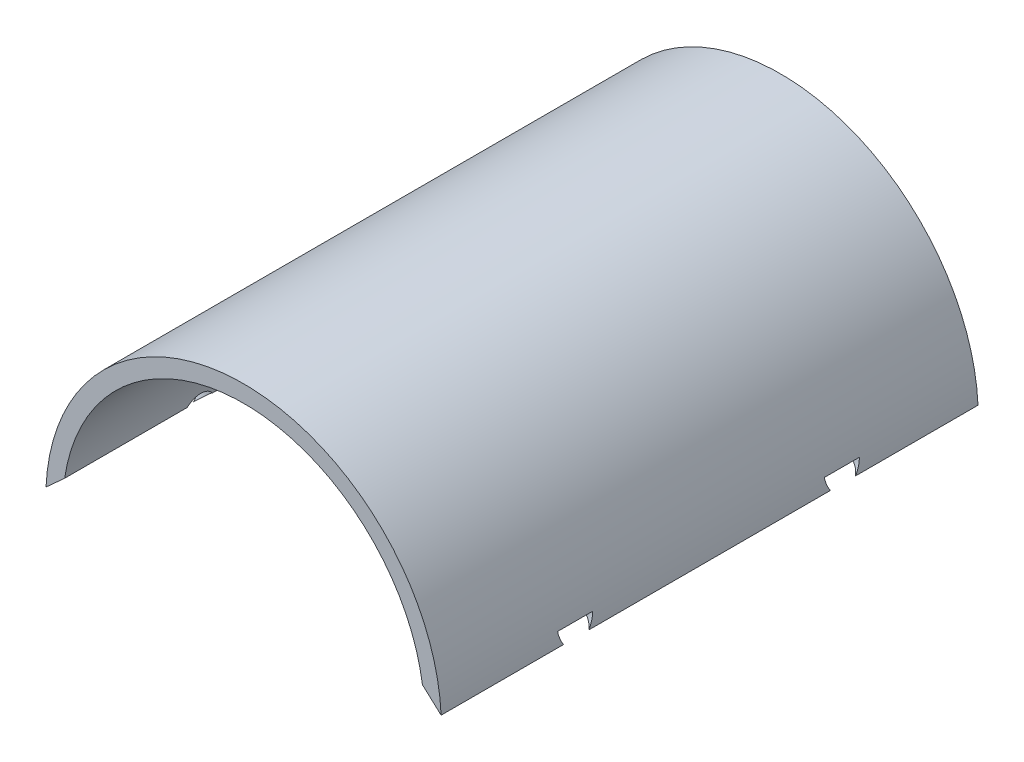
from build123d import *

# Parameters (mm, degrees)
BOSS_EXTRUDE1_DEPTH = 120.65
SKETCH2_R           = 4
CUT_EXTRUDE1_DEPTH  = 2
SKETCH3_R           = 4
CUT_EXTRUDE2_DEPTH  = 2.032


with BuildPart() as part:
    # Sketch1 → Boss-Extrude1 (new body)
    with BuildSketch(Plane.XY):
        with BuildLine():
            Line((-40.203883769, 5.937788296), (-44.399042974, 2.127788296))
            ThreePointArc((-44.399042974, 2.127788296), (0, 44.45), (44.399042974, 2.127788296))
            Line((44.399042974, 2.127788296), (40.203883769, 5.937788296))
            ThreePointArc((40.203883769, 5.937788296), (0, 40.64), (-40.203883769, 5.937788296))
        make_face()
    extrude(amount=BOSS_EXTRUDE1_DEPTH)

    # Sketch2 → Cut-Extrude1 (cut)
    with BuildSketch(Plane(origin=(-21.127225221, 23.263011377, 0), x_dir=(0.7402720771062569, 0.6723074087475075, 0), z_dir=(0.6723074087475075, -0.7402720771062569, 0))):
        with Locations((-28.603318705, 90.297)):
            Circle(SKETCH2_R)
        with Locations((-28.603318705, 30.353)):
            Circle(SKETCH2_R)
    extrude(amount=-CUT_EXTRUDE1_DEPTH, mode=Mode.SUBTRACT)

    # Sketch3 → Cut-Extrude2 (cut)
    with BuildSketch(Plane(origin=(21.127225221, 23.263011377, 0), x_dir=(-0.7402720771062569, 0.6723074087475075, 0), z_dir=(-0.6723074087475075, -0.7402720771062569, 0))):
        with Locations((-28.603318705, -90.297)):
            Circle(SKETCH3_R)
        with Locations((-28.603318705, -30.353)):
            Circle(SKETCH3_R)
    extrude(amount=-CUT_EXTRUDE2_DEPTH, mode=Mode.SUBTRACT)


solid = part.part
